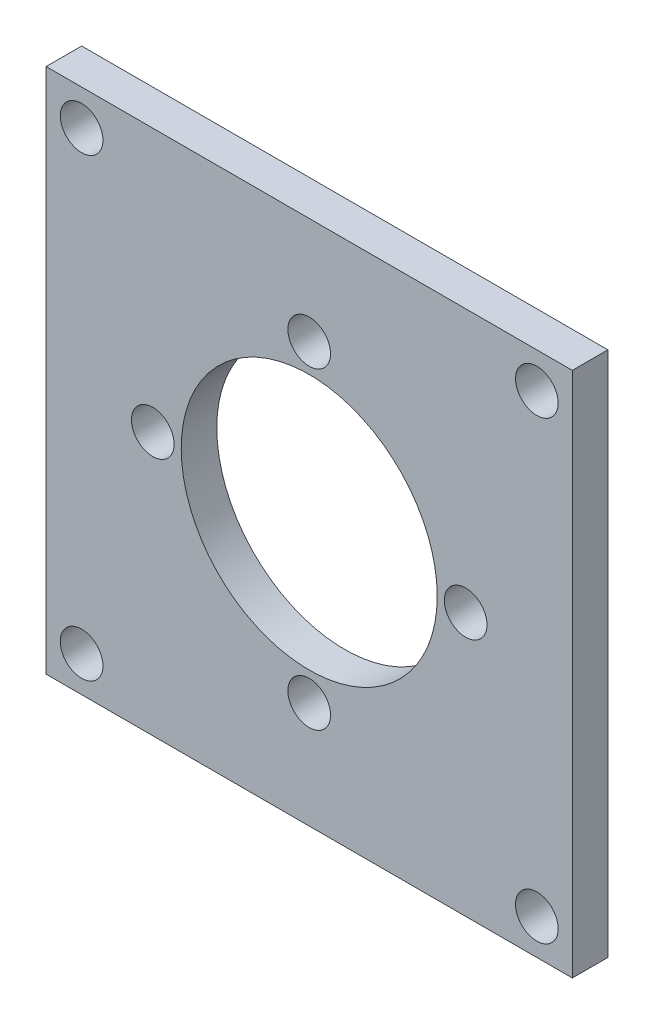
from build123d import *

# Parameters (mm, degrees)
SKETCH1_W           = 37
SKETCH1_H           = 37
BOSS_EXTRUDE1_DEPTH = 2.5
SKETCH3_R           = 9
CUT_EXTRUDE1_DEPTH  = 27.282123202
SKETCH11_R          = 1.5
CUT_EXTRUDE2_DEPTH  = 27.282123202
SKETCH12_R          = 1.5
CUT_EXTRUDE3_DEPTH  = 27.282123202


with BuildPart() as part:
    # Sketch1 → Boss-Extrude1 (new body)
    with BuildSketch(Plane.XY):
        Rectangle(SKETCH1_W, SKETCH1_H)
    extrude(amount=BOSS_EXTRUDE1_DEPTH)

    # Sketch3 → Cut-Extrude1 (cut, through all)
    with BuildSketch(Plane.XY.offset(2.5)):
        Circle(SKETCH3_R)
    extrude(amount=-CUT_EXTRUDE1_DEPTH, mode=Mode.SUBTRACT)

    # Sketch11 → Cut-Extrude2 (cut, through all)
    with BuildSketch(Plane.XY.offset(2.5)):
        with Locations((-16.003913062, 16.003913062)):
            Circle(SKETCH11_R)
        with Locations((16.003913062, 16.003913062)):
            Circle(SKETCH11_R)
        with Locations((-16.003913062, -16.003913062)):
            Circle(SKETCH11_R)
        with Locations((16.003913062, -16.003913062)):
            Circle(SKETCH11_R)
    extrude(amount=-CUT_EXTRUDE2_DEPTH, mode=Mode.SUBTRACT)

    # Sketch12 → Cut-Extrude3 (cut, through all)
    with BuildSketch(Plane.XY.offset(2.5)):
        with Locations((0, 11)):
            Circle(SKETCH12_R)
        with Locations((11, 0)):
            Circle(SKETCH12_R)
        with Locations((-11, 0)):
            Circle(SKETCH12_R)
        with Locations((0, -11)):
            Circle(SKETCH12_R)
    extrude(amount=-CUT_EXTRUDE3_DEPTH, mode=Mode.SUBTRACT)


solid = part.part
